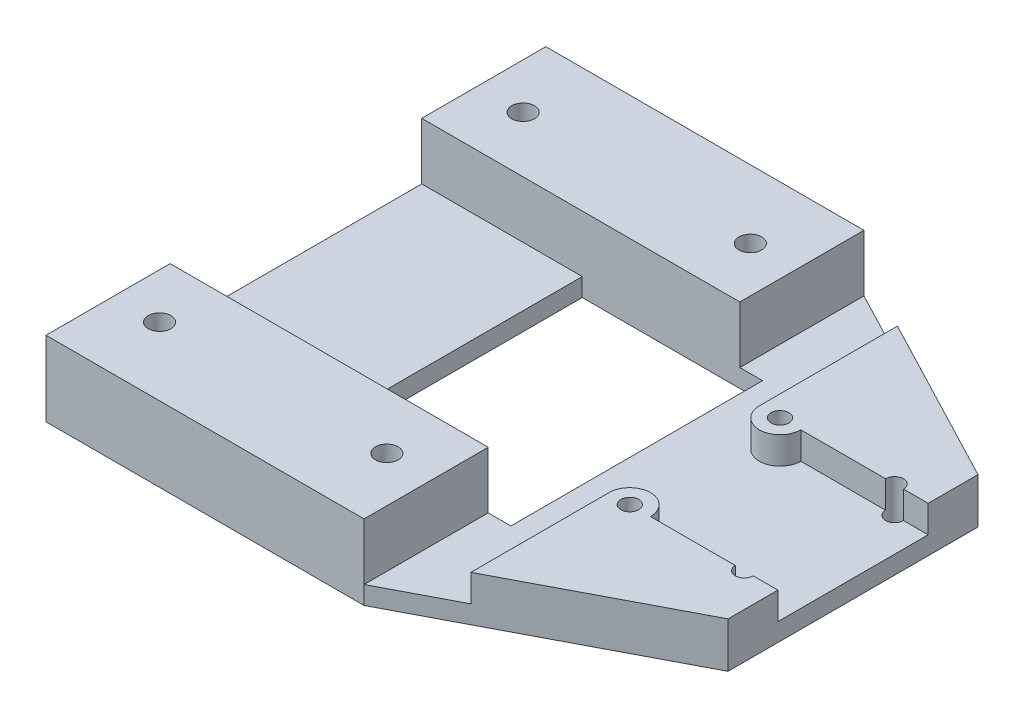
from build123d import *

# Parameters (mm, degrees)
SKETCH1_R           = 1.5875
SKETCH1_R_2         = 1.25
BOSS_EXTRUDE1_DEPTH = 2.54
CUT_EXTRUDE1_DEPTH  = 2.54
SKETCH3_R           = 1.25
BOSS_EXTRUDE2_DEPTH = 3.81
SKETCH5_W           = 44.45
SKETCH5_H           = 17.343016279
SKETCH5_R           = 1.5875
BOSS_EXTRUDE3_DEPTH = 7.9375


with BuildPart() as part:
    # Sketch1 → Boss-Extrude1 (new body)
    with BuildSketch(Plane(origin=(0, 0, 0), x_dir=(1, 0, 0), z_dir=(0, 1, 0))):
        Polygon((55.625, 17.4625), (22.225, 34.925), (-22.225, 34.925), (-22.225, -34.925), (22.225, -34.925), (55.625, -17.4625), align=None)
        with Locations((-15.875, 25.4)):
            Circle(SKETCH1_R, mode=Mode.SUBTRACT)
        with Locations((15.875, 25.4)):
            Circle(SKETCH1_R, mode=Mode.SUBTRACT)
        with Locations((15.875, -25.4)):
            Circle(SKETCH1_R, mode=Mode.SUBTRACT)
        with Locations((-15.875, -25.4)):
            Circle(SKETCH1_R, mode=Mode.SUBTRACT)
        with Locations((50.925, 10.5)):
            Circle(SKETCH1_R_2, mode=Mode.SUBTRACT)
        with Locations((50.925, -10.5)):
            Circle(SKETCH1_R_2, mode=Mode.SUBTRACT)
        with Locations((34.925, -10.5)):
            Circle(SKETCH1_R_2, mode=Mode.SUBTRACT)
        with Locations((34.925, 10.5)):
            Circle(SKETCH1_R_2, mode=Mode.SUBTRACT)
    extrude(amount=BOSS_EXTRUDE1_DEPTH)

    # Sketch2 → Cut-Extrude1 (cut)
    with BuildSketch(Plane(origin=(0, 2.54, 0), x_dir=(1, 0, 0), z_dir=(0, 1, 0))):
        Polygon((22.225, 17.581983721), (25.4, 17.581983721), (25.4, -17.581983721), (22.225, -17.581983721), (0.201756104, -17.581983721), (0.201756104, 17.581983721), align=None)
    extrude(amount=-CUT_EXTRUDE1_DEPTH, mode=Mode.SUBTRACT)

    # Sketch3 → Boss-Extrude2 (add)
    # profile 1 of 2: a face of its own
    with BuildSketch(Plane(origin=(0, 2.54, 0), x_dir=(1, 0, 0), z_dir=(0, 1, 0))):
        with BuildLine():
            Line((55.625, 10.5), (52.175, 10.5))
            ThreePointArc((52.175, 10.5), (50.925, 11.75), (49.675, 10.5))
            Line((49.675, 10.5), (37.823479459, 10.5))
            ThreePointArc((37.823479459, 10.5), (34.925, 7.601520541), (32.026520541, 10.5))
            Line((32.026520541, 10.5), (32.026520541, 29.800477472))
            Line((32.026520541, 29.800477472), (55.625, 17.4625))
            Line((55.625, 17.4625), (55.625, 10.5))
        make_face()
        with Locations((34.925, 10.5)):
            Circle(SKETCH3_R, mode=Mode.SUBTRACT)
    # profile 2 of 2: a face of its own
    with BuildSketch(Plane(origin=(0, 2.54, 0), x_dir=(1, 0, 0), z_dir=(0, 1, 0))):
        with BuildLine():
            Line((55.625, -17.4625), (55.625, -10.5))
            Line((55.625, -10.5), (52.175, -10.5))
            ThreePointArc((52.175, -10.5), (50.925, -11.75), (49.675, -10.5))
            Line((49.675, -10.5), (37.823479459, -10.5))
            ThreePointArc((37.823479459, -10.5), (34.925, -7.601520541), (32.026520541, -10.5))
            Line((32.026520541, -10.5), (32.026520541, -29.800477472))
            Line((32.026520541, -29.800477472), (55.625, -17.4625))
        make_face()
        with Locations((34.925, -10.5)):
            Circle(SKETCH3_R, mode=Mode.SUBTRACT)
    extrude(amount=BOSS_EXTRUDE2_DEPTH)

    # Sketch5 → Boss-Extrude3 (add)
    # profile 1 of 2: a face of its own
    with BuildSketch(Plane(origin=(0, 2.54, 0), x_dir=(1, 0, 0), z_dir=(0, 1, 0))):
        with Locations((0, 26.253491861)):
            Rectangle(SKETCH5_W, SKETCH5_H)
        with Locations((-15.875, 25.4)):
            Circle(SKETCH5_R, mode=Mode.SUBTRACT)
        with Locations((15.875, 25.4)):
            Circle(SKETCH5_R, mode=Mode.SUBTRACT)
    # profile 2 of 2: a face of its own
    with BuildSketch(Plane(origin=(0, 2.54, 0), x_dir=(1, 0, 0), z_dir=(0, 1, 0))):
        with Locations((0, -26.253491861)):
            Rectangle(SKETCH5_W, SKETCH5_H)
        with Locations((15.875, -25.4)):
            Circle(SKETCH5_R, mode=Mode.SUBTRACT)
        with Locations((-15.875, -25.4)):
            Circle(SKETCH5_R, mode=Mode.SUBTRACT)
    extrude(amount=BOSS_EXTRUDE3_DEPTH)


solid = part.part
